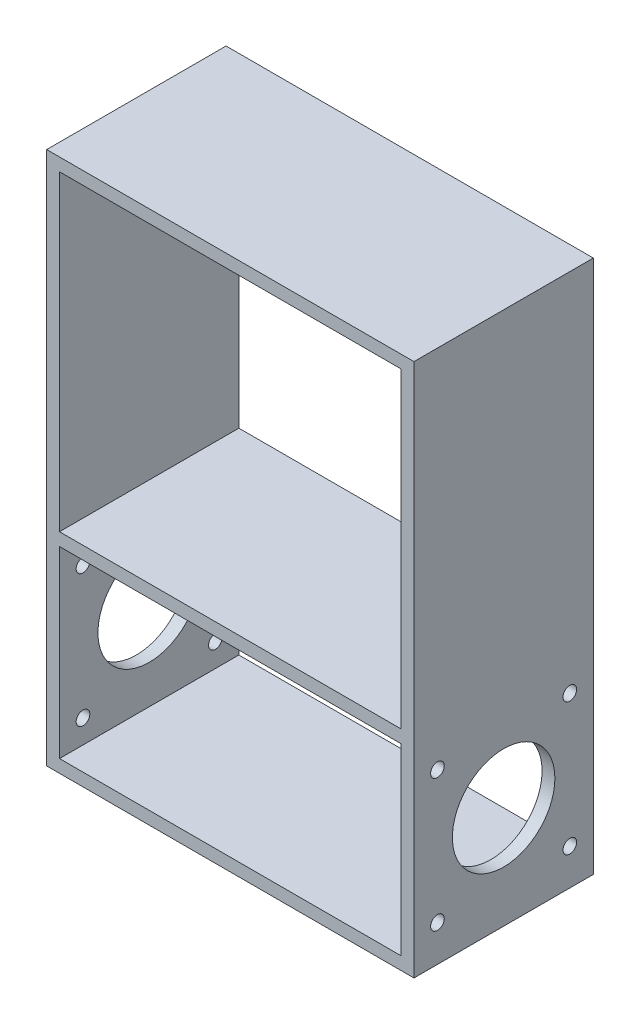
from build123d import *

# Parameters (mm, degrees)
SKETCH1_W           = 42
SKETCH1_H           = 125
SKETCH1_R           = 1.6
SKETCH1_R_2         = 12
BOSS_EXTRUDE1_DEPTH = 3
SKETCH4_W           = 42
SKETCH4_H           = 3
BOSS_EXTRUDE2_DEPTH = 40


with BuildPart() as part:
    # Sketch1 → Boss-Extrude1 (new body)
    with BuildSketch(Plane(origin=(0, 0, 0), x_dir=(0, 0, -1), z_dir=(1, 0, 0))):
        with Locations((0, 38.5)):
            Rectangle(SKETCH1_W, SKETCH1_H)
        with Locations((-15.5, -15.5)):
            Circle(SKETCH1_R, mode=Mode.SUBTRACT)
        Circle(SKETCH1_R_2, mode=Mode.SUBTRACT)
        with Locations((-15.5, 15.5)):
            Circle(SKETCH1_R, mode=Mode.SUBTRACT)
        with Locations((15.5, -15.5)):
            Circle(SKETCH1_R, mode=Mode.SUBTRACT)
        with Locations((15.5, 15.5)):
            Circle(SKETCH1_R, mode=Mode.SUBTRACT)
    boss_extrude1 = extrude(amount=BOSS_EXTRUDE1_DEPTH)

    # Sketch4 → Boss-Extrude2 (add)
    with BuildSketch(Plane.ZY):
        with Locations((0, -22.5)):
            Rectangle(SKETCH4_W, SKETCH4_H)
        with Locations((0, 23.5)):
            Rectangle(SKETCH4_W, SKETCH4_H)
        with Locations((0, 99.5)):
            Rectangle(SKETCH4_W, SKETCH4_H)
    boss_extrude2 = extrude(amount=BOSS_EXTRUDE2_DEPTH)

    # Mirror3: Boss-Extrude1, Boss-Extrude2 across plane
    add(boss_extrude1.mirror(Plane.ZY.offset(40)))
    add(boss_extrude2.mirror(Plane.ZY.offset(40)))


solid = part.part
